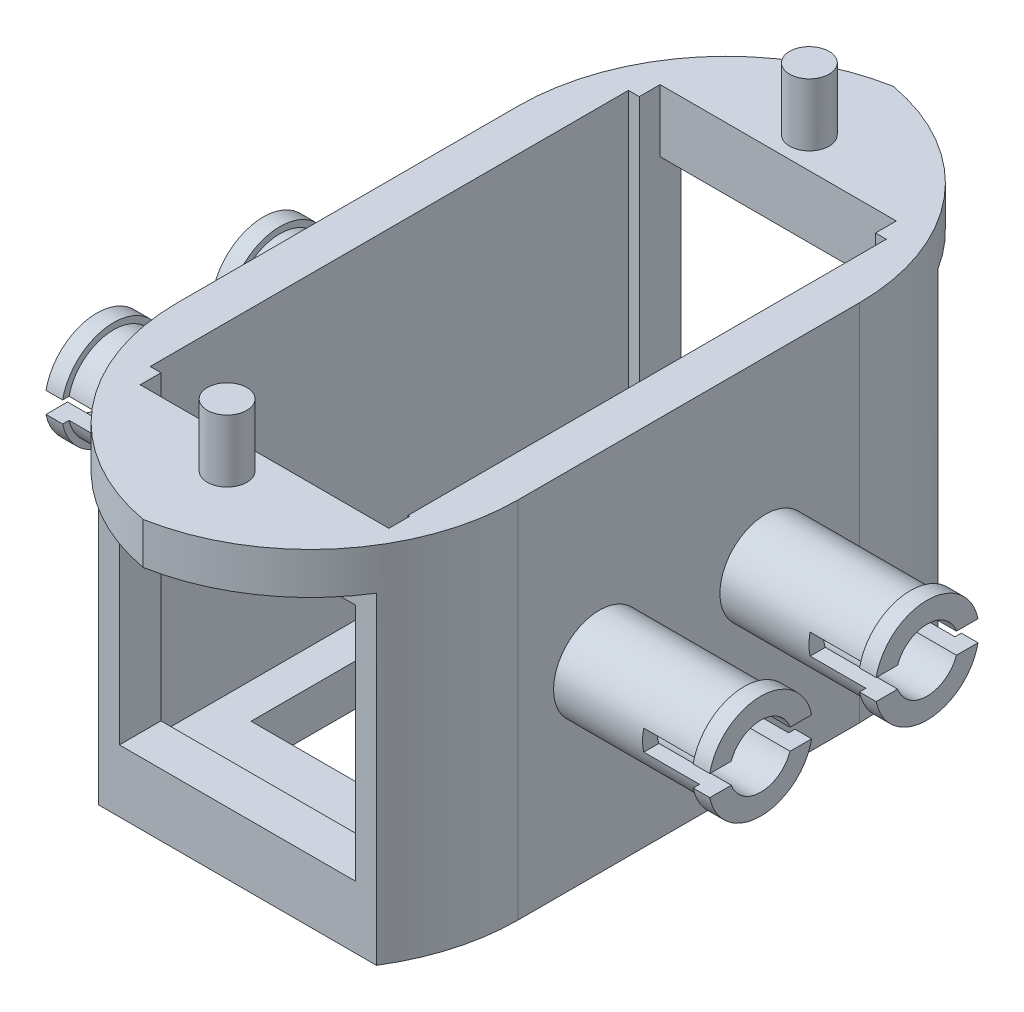
from build123d import *

# Parameters (mm, degrees)
SKETCH1_W           = 16.4
SKETCH1_H           = 27
BOSS_EXTRUDE1_DEPTH = 2
SKETCH5_W           = 16.4
SKETCH5_H           = 27
SKETCH5_W_2         = 12.4
SKETCH5_H_2         = 23
BOSS_EXTRUDE2_DEPTH = 15.5
SKETCH6_W           = 16.4
SKETCH6_H           = 2
BOSS_EXTRUDE3_DEPTH = 4.7
SKETCH7_W           = 16.4
SKETCH7_H           = 2
BOSS_EXTRUDE4_DEPTH = 4.7
SKETCH8_R           = 0.95
BOSS_EXTRUDE5_DEPTH = 3
FILLET1_R           = 10
SKETCH9_R           = 2.2
BOSS_EXTRUDE6_DEPTH = 6.96
BOSS_EXTRUDE7_START = 6.96
SKETCH10_R          = 2.2
BOSS_EXTRUDE7_DEPTH = 6.96
SKETCH11_W          = 11.35995283
SKETCH11_H          = 11.5
CUT_EXTRUDE1_DEPTH  = 45.277544069
SKETCH12_W          = 9
SKETCH12_H          = 16.693548388
CUT_EXTRUDE2_DEPTH  = 10
SKETCH14_W          = 11.35995283
SKETCH14_H          = 3
CUT_EXTRUDE5_DEPTH  = 1
SKETCH15_W          = 11.95995283
SKETCH15_H          = 3
CUT_EXTRUDE6_DEPTH  = 1
SKETCH16_R          = 2.5
BOSS_EXTRUDE8_DEPTH = 0.8
BOSS_EXTRUDE9_START = 0.8
SKETCH17_R          = 2.5
BOSS_EXTRUDE9_DEPTH = 0.8
SKETCH18_W          = 6.099763115
SKETCH18_H          = 1
CUT_EXTRUDE7_DEPTH  = 3.48
CUT_EXTRUDE8_DEPTH  = 3.48
SKETCH20_R          = 1.5
CUT_EXTRUDE9_DEPTH  = 7.76
CUT_EXTRUDE10_START = -7.76
SKETCH21_R          = 1.5
CUT_EXTRUDE10_DEPTH = 7.76


with BuildPart() as part:
    # Sketch1 → Boss-Extrude1 (new body)
    with BuildSketch(Plane(origin=(0, 0, 0), x_dir=(1, 0, 0), z_dir=(0, 1, 0))):
        with Locations((8.2, 13.5)):
            Rectangle(SKETCH1_W, SKETCH1_H)
    extrude(amount=BOSS_EXTRUDE1_DEPTH)

    # Sketch5 → Boss-Extrude2 (add)
    with BuildSketch(Plane(origin=(0, 2, 0), x_dir=(1, 0, 0), z_dir=(0, 1, 0))):
        with Locations((8.2, 13.5)):
            Rectangle(SKETCH5_W, SKETCH5_H)
        with Locations((8.2, 13.5)):
            Rectangle(SKETCH5_W_2, SKETCH5_H_2, mode=Mode.SUBTRACT)
    extrude(amount=BOSS_EXTRUDE2_DEPTH)

    # Sketch6 → Boss-Extrude3 (add)
    with BuildSketch(Plane(origin=(0, 0, -27), x_dir=(-1, 0, 0), z_dir=(0, 0, -1))):
        with Locations((-8.2, 16.5)):
            Rectangle(SKETCH6_W, SKETCH6_H)
    extrude(amount=BOSS_EXTRUDE3_DEPTH)

    # Sketch7 → Boss-Extrude4 (add)
    with BuildSketch(Plane.XY):
        with Locations((8.2, 16.5)):
            Rectangle(SKETCH7_W, SKETCH7_H)
    extrude(amount=BOSS_EXTRUDE4_DEPTH)

    # Sketch8 → Boss-Extrude5 (add)
    with BuildSketch(Plane(origin=(0, 17.5, 0), x_dir=(1, 0, 0), z_dir=(0, 1, 0))):
        with Locations(Location((8.2, 27.5, 0), (0, 0, 90))):
            Circle(SKETCH8_R)
        with Locations(Location((8.2, -0.5, 0), (0, 0, 90))):
            Circle(SKETCH8_R)
    extrude(amount=BOSS_EXTRUDE5_DEPTH)

    # Fillet1
    # the kernel refuses this fillet: 10 mm, written as the material it takes off along each edge
    with BuildSketch(Plane(origin=(16.4, -9.5, -31.7), x_dir=(0, 0, 1), z_dir=(0, 1, 0)), Plane(origin=(0, 42.5, -31.7), x_dir=(0, 0, 1), z_dir=(0, -1, 0)), Plane(origin=(16.4, 42.5, 4.7), x_dir=(0, 0, -1), z_dir=(0, -1, 0)), Plane(origin=(0, -9.5, 4.7), x_dir=(0, 0, -1), z_dir=(0, 1, 0))) as fillet1_piece_1:
        with BuildLine():
            CenterArc((FILLET1_R, -FILLET1_R), FILLET1_R, 90, 90)
            Line((0, -FILLET1_R), (0, 0))
            Line((0, 0), (FILLET1_R, 0))
        make_face()
    extrude(amount=52, mode=Mode.SUBTRACT)

    # Sketch9 → Boss-Extrude6 (add)
    with BuildSketch(Plane.ZY):
        with Locations(Location((-17.2, 8.75, 0), (0, 0, 180))):
            Circle(SKETCH9_R)
        with Locations(Location((-9.2, 8.75, 0), (0, 0, 180))):
            Circle(SKETCH9_R)
    extrude(amount=BOSS_EXTRUDE6_DEPTH)

    # Sketch10 → Boss-Extrude7 (add)
    with BuildSketch(Plane(origin=(16.4, 0, 0), x_dir=(0, 0, -1), z_dir=(1, 0, 0)).offset(BOSS_EXTRUDE7_START)):
        with Locations((9.2, 8.75)):
            Circle(SKETCH10_R)
        with Locations((17.2, 8.75)):
            Circle(SKETCH10_R)
    extrude(amount=-BOSS_EXTRUDE7_DEPTH)

    # Sketch11 → Cut-Extrude1 (cut, through all)
    with BuildSketch(Plane.XY):
        with Locations((8.2, 8.75)):
            Rectangle(SKETCH11_W, SKETCH11_H)
    extrude(amount=-CUT_EXTRUDE1_DEPTH, mode=Mode.SUBTRACT)

    # Sketch12 → Cut-Extrude2 (cut)
    with BuildSketch(Plane(origin=(0, 2, 0), x_dir=(1, 0, 0), z_dir=(0, 1, 0))):
        with Locations((8.2, 13.5)):
            Rectangle(SKETCH12_W, SKETCH12_H)
    extrude(amount=-CUT_EXTRUDE2_DEPTH, mode=Mode.SUBTRACT)

    # Sketch14 → Cut-Extrude5 (cut)
    with BuildSketch(Plane.XY.offset(-25)):
        with Locations((8.2, 16)):
            Rectangle(SKETCH14_W, SKETCH14_H)
    extrude(amount=-CUT_EXTRUDE5_DEPTH, mode=Mode.SUBTRACT)

    # Sketch15 → Cut-Extrude6 (cut)
    with BuildSketch(Plane(origin=(0, 0, -2), x_dir=(-1, 0, 0), z_dir=(0, 0, -1))):
        with Locations((-8.5, 16)):
            Rectangle(SKETCH15_W, SKETCH15_H)
    extrude(amount=-CUT_EXTRUDE6_DEPTH, mode=Mode.SUBTRACT)

    # Sketch16 → Boss-Extrude8 (add)
    with BuildSketch(Plane(origin=(23.36, 0, 0), x_dir=(0, 0, -1), z_dir=(1, 0, 0))):
        with Locations((9.2, 8.75)):
            Circle(SKETCH16_R)
        with Locations((17.2, 8.75)):
            Circle(SKETCH16_R)
    extrude(amount=BOSS_EXTRUDE8_DEPTH)

    # Sketch17 → Boss-Extrude9 (add)
    with BuildSketch(Plane.ZY.offset(6.96).offset(BOSS_EXTRUDE9_START)):
        with Locations(Location((-9.2, 8.75, 0), (0, 0, 180))):
            Circle(SKETCH17_R)
        with Locations(Location((-17.2, 8.75, 0), (0, 0, 180))):
            Circle(SKETCH17_R)
    extrude(amount=-BOSS_EXTRUDE9_DEPTH)

    # Sketch18 → Cut-Extrude7 (cut)
    with BuildSketch(Plane.ZY.offset(7.76)):
        with Locations((-17.37045616, 8.75)):
            Rectangle(SKETCH18_W, SKETCH18_H)
        Polygon((-6.209519779, 8.75), (-6.209519779, 8.25), (-12.153333116, 8.25), (-12.153333116, 9.25), (-6.209519779, 9.25), align=None)
    extrude(amount=-CUT_EXTRUDE7_DEPTH, mode=Mode.SUBTRACT)

    # Sketch19 → Cut-Extrude8 (cut)
    with BuildSketch(Plane(origin=(24.16, 0, 0), x_dir=(0, 0, -1), z_dir=(1, 0, 0))):
        Polygon((6.297180826, 8.75), (6.297180826, 9.25), (20.308323275, 9.25), (20.308323275, 8.25), (6.297180826, 8.25), align=None)
    extrude(amount=-CUT_EXTRUDE8_DEPTH, mode=Mode.SUBTRACT)

    # Sketch20 → Cut-Extrude9 (cut)
    with BuildSketch(Plane(origin=(24.16, 0, 0), x_dir=(0, 0, -1), z_dir=(1, 0, 0))):
        with Locations((9.2, 8.75)):
            Circle(SKETCH20_R)
        with Locations((17.2, 8.75)):
            Circle(SKETCH20_R)
    extrude(amount=-CUT_EXTRUDE9_DEPTH, mode=Mode.SUBTRACT)

    # Sketch21 → Cut-Extrude10 (cut)
    with BuildSketch(Plane.ZY.offset(7.76).offset(CUT_EXTRUDE10_START)):
        with Locations(Location((-9.2, 8.75, 0), (0, 0, 180))):
            Circle(SKETCH21_R)
        with Locations(Location((-17.2, 8.75, 0), (0, 0, 180))):
            Circle(SKETCH21_R)
    extrude(amount=CUT_EXTRUDE10_DEPTH, mode=Mode.SUBTRACT)


solid = part.part
